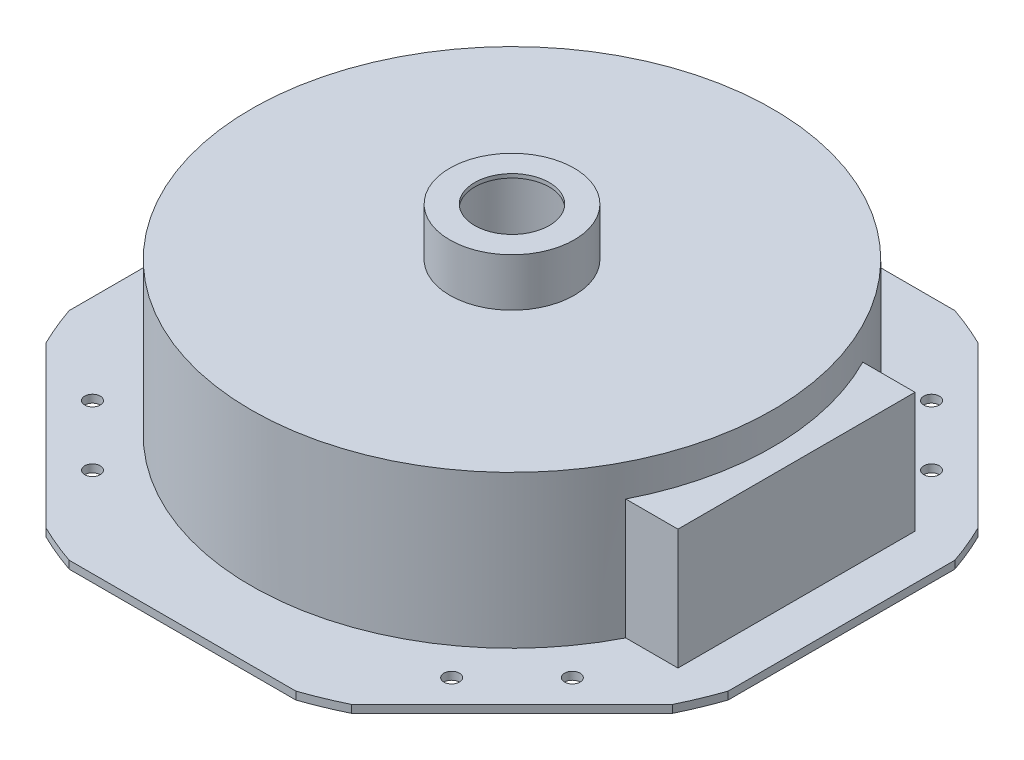
from build123d import *

# Parameters (mm, degrees)
EXTRUDE_1_DEPTH          = 10
SKETCH_2_R               = 335.5
EXTRUDE_2_DEPTH          = 196
EXTRUDE_4_DEPTH          = 154.8
SHELL_START              = 10
SHELL_4_OUTLINE_R        = 330.5
SHELL_4_DEPTH            = 191
SHELL_4_2_DEPTH          = 149.8
CUT_EXTRUDE_2_DEPTH      = 196
SKETCH_6_R               = 80
EXTRUDE_6_DEPTH          = 66.8
SKETCH_6_2_R             = 80
EXTRUDE_7_DEPTH          = 123.6
SKETCH_7_R               = 75
CUT_EXTRUDE_3_DEPTH      = 185.4
SKETCH_9_R               = 10
CUT_EXTRUDE_11_DEPTH     = 25
PATTERN_CIRCULAR_1_COUNT = 4
RIB_START                = -5
RIB_1_DEPTH              = 10
PATTERN_CIRCULAR_3_COUNT = 6
SKETCH_13_R              = 48
CUT_EXTRUDE_12_DEPTH     = 657.646057629


# Read off the part's stored shape, not the designer's step: 抽壳4, 筋1
with BuildPart() as part:
    # 草图1 → 凸台-拉伸1 (new body)
    with BuildSketch(Plane(origin=(0, 0, 0), x_dir=(1, 0, 0), z_dir=(0, 1, 0))):
        with BuildLine():
            ThreePointArc((-145.890781066, 423.95), (-171.576116901, 414.221388401), (-196.61755928, 402.938280488))
            Line((-196.61755928, 402.938280488), (-402.938280488, 196.61755928))
            ThreePointArc((-402.938280488, 196.61755928), (-414.221388401, 171.576116901), (-423.95, 145.890781066))
            Line((-423.95, 145.890781066), (-423.95, -145.890781066))
            ThreePointArc((-423.95, -145.890781066), (-414.221388401, -171.576116901), (-402.938280488, -196.61755928))
            Line((-402.938280488, -196.61755928), (-196.61755928, -402.938280488))
            ThreePointArc((-196.61755928, -402.938280488), (-171.576116901, -414.221388401), (-145.890781066, -423.95))
            Line((-145.890781066, -423.95), (145.890781066, -423.95))
            ThreePointArc((145.890781066, -423.95), (171.576116901, -414.221388401), (196.61755928, -402.938280488))
            Line((196.61755928, -402.938280488), (402.938280488, -196.61755928))
            ThreePointArc((402.938280488, -196.61755928), (414.221388401, -171.576116901), (423.95, -145.890781066))
            Line((423.95, -145.890781066), (423.95, 145.890781066))
            ThreePointArc((423.95, 145.890781066), (414.221388401, 171.576116901), (402.938280488, 196.61755928))
            Line((402.938280488, 196.61755928), (196.61755928, 402.938280488))
            ThreePointArc((196.61755928, 402.938280488), (171.576116901, 414.221388401), (145.890781066, 423.95))
            Line((145.890781066, 423.95), (-145.890781066, 423.95))
        make_face()
    extrude(amount=EXTRUDE_1_DEPTH)

    # 草图5 → 切除-拉伸2 (cut)
    with BuildSketch(Plane.XZ.offset(-10)):
        with BuildLine():
            Line((356, -142.5), (292.649961558, -142.5))
            ThreePointArc((292.649961558, -142.5), (-325.5, 0), (292.649961558, 142.5))
            Line((292.649961558, 142.5), (356, 142.5))
            Line((356, 142.5), (356, -142.5))
        make_face()
    extrude(amount=CUT_EXTRUDE_2_DEPTH, mode=Mode.SUBTRACT)


with BuildPart() as body_2:
    # 草图2 → 凸台-拉伸2 (new body)
    with BuildSketch(Plane(origin=(0, 10, 0), x_dir=(1, 0, 0), z_dir=(0, 1, 0))):
        with Locations(Location((0, 0, 0), (0, 0, 270))):
            Circle(SKETCH_2_R)
    extrude(amount=EXTRUDE_2_DEPTH)


with BuildPart() as body_3:
    # 草图3 → 凸台-拉伸4 (new body)
    with BuildSketch(Plane(origin=(0, 10, 0), x_dir=(1, 0, 0), z_dir=(0, 1, 0))):
        with BuildLine():
            Line((366, 152.5), (366, -152.5))
            Line((366, -152.5), (298.83774862, -152.5))
            ThreePointArc((298.83774862, -152.5), (335.5, 0), (298.83774862, 152.5))
            Line((298.83774862, 152.5), (366, 152.5))
        make_face()
    extrude(amount=EXTRUDE_4_DEPTH)


with BuildPart() as body_2_1:
    add(body_2.part)

    # Combine 1: union body 3
    add(body_3.part)

    # 抽壳4 outline → 抽壳4 (cut)
    with BuildSketch(Plane(origin=(0, 0, 0), x_dir=(1, 0, 0), z_dir=(0, 1, 0)).offset(SHELL_START)):
        Circle(SHELL_4_OUTLINE_R)
    extrude(amount=SHELL_4_DEPTH, mode=Mode.SUBTRACT)

    # Shell 4 2 outline → Shell 4 2 (cut)
    with BuildSketch(Plane(origin=(0, 0, 0), x_dir=(1, 0, 0), z_dir=(0, 1, 0)).offset(SHELL_START)):
        with BuildLine():
            ThreePointArc((295.760037869, 147.5), (330.5, 0), (295.760037869, -147.5))
            Line((295.760037869, -147.5), (361, -147.5))
            Line((361, -147.5), (361, 147.5))
            Line((361, 147.5), (295.760037869, 147.5))
        make_face()
    extrude(amount=SHELL_4_2_DEPTH, mode=Mode.SUBTRACT)

    # Combine 2: union part
    add(part.part)

    # 草图6 → 凸台-拉伸6 (add)
    with BuildSketch(Plane.XZ.offset(-201)):
        with Locations(Location((0, 0, 0), (0, 0, 90))):
            Circle(SKETCH_6_R)
    extrude(amount=-EXTRUDE_6_DEPTH)

    # 草图6<2> → 凸台-拉伸7 (add)
    with BuildSketch(Plane.XZ.offset(-201)):
        with Locations(Location((0, 0, 0), (0, 0, 90))):
            Circle(SKETCH_6_2_R)
    extrude(amount=EXTRUDE_7_DEPTH)

    # 草图7 → 切除-拉伸3 (cut)
    with BuildSketch(Plane.XZ.offset(-77.4)):
        with Locations(Location((0, 0, 0), (0, 0, 270))):
            Circle(SKETCH_7_R)
    extrude(amount=-CUT_EXTRUDE_3_DEPTH, mode=Mode.SUBTRACT)

    # 草图9 → 切除-拉伸11 (cut)
    with BuildSketch(Plane.XZ):
        with Locations(Location((-308.701607463, 231.061282888, 0), (0, 0, 270))):
            Circle(SKETCH_9_R)
        with Locations(Location((-231.061282888, 308.701607463, 0), (0, 0, 270))):
            Circle(SKETCH_9_R)
    cut_extrude_11 = extrude(amount=-CUT_EXTRUDE_11_DEPTH, mode=Mode.SUBTRACT)

    # 阵列(圆周)1: 切除-拉伸11 ×4 about axis
    pattern_circular_1_axis = Axis((0, 0, 0), (0, 1, 0))
    for i in range(1, PATTERN_CIRCULAR_1_COUNT):
        add(cut_extrude_11.rotate(pattern_circular_1_axis, i * 360 / PATTERN_CIRCULAR_1_COUNT), mode=Mode.SUBTRACT)

    # 筋1 outline → 筋1 (add)
    with BuildSketch(Plane.XY.offset(RIB_START)):
        Polygon((-330.5, 104.315910213), (-79.843597113, 82.38631652), (-78, 82.225022673), (-78, 201), (-332, 201), (-332, 104.447143208), align=None)
    rib_1 = extrude(amount=RIB_1_DEPTH)

    # 阵列(圆周)3: 筋1 ×6 about axis, 1 skipped
    pattern_circular_3_axis = Axis((0, 0, 0), (0, 1, 0))
    add([rib_1.rotate(pattern_circular_3_axis, i * 360 / PATTERN_CIRCULAR_3_COUNT) for i in range(1, PATTERN_CIRCULAR_3_COUNT) if i not in (3,)])

    # 草图13 → 切除-拉伸12 (cut, through all)
    with BuildSketch(Plane(origin=(0, 267.8, 0), x_dir=(1, 0, 0), z_dir=(0, 1, 0))):
        with Locations(Location((0, 0, 0), (0, 0, 270))):
            Circle(SKETCH_13_R)
    extrude(amount=-CUT_EXTRUDE_12_DEPTH, mode=Mode.SUBTRACT)


solid = body_2_1.part
